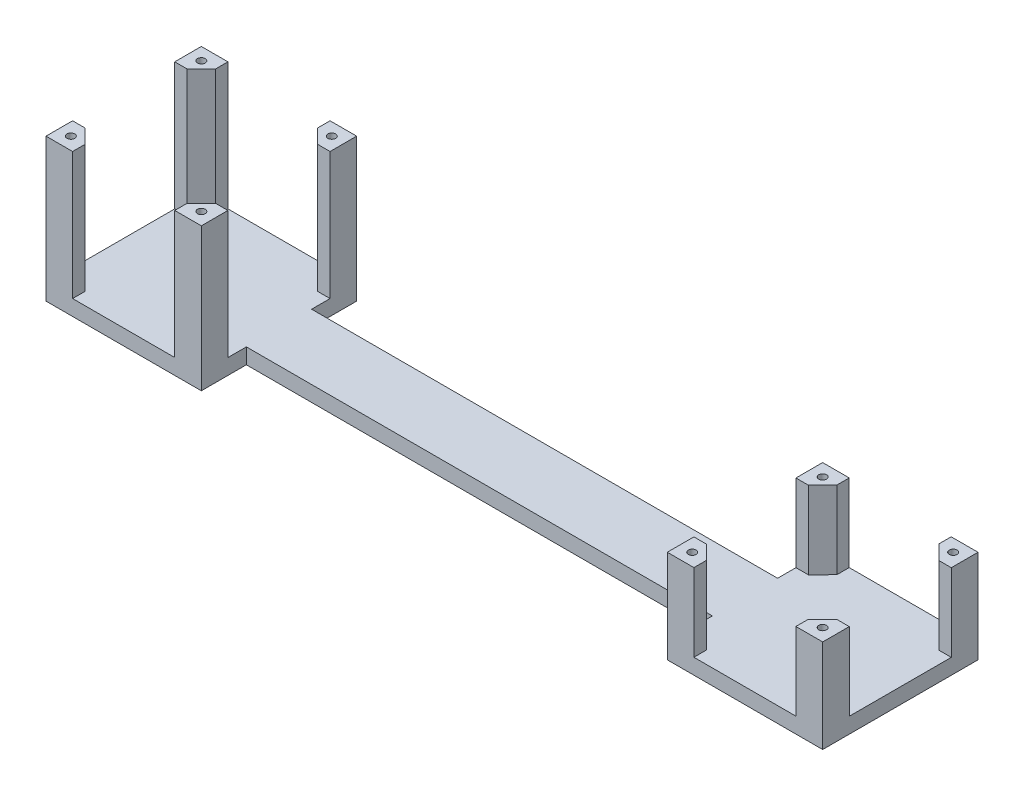
from build123d import *

# Parameters (mm, degrees)
BASE_EXTR_DEPTH                 = 5
MOTOR_1_EXTR_DEPTH              = 41
SHAFT_MOTOR_SUPPORT_EXTR_DEPTH  = 25
TAP_DRILL_FOR_M3X0_5_TAP1_D     = 2.5
TAP_DRILL_FOR_M3X0_5_TAP1_DEPTH = 41
TAP_DRILL_FOR_M3X0_5_TAP1_TIP   = 0.751075774


with BuildPart() as part:
    # Base_sch → base_extr (new body)
    with BuildSketch(Plane(origin=(0, 0, 0), x_dir=(1, 0, 0), z_dir=(0, 1, 0))):
        Polygon((25, 10.5), (25, 25), (-25, 25), (-25, -25), (25, -25), (25, -10.5), (175, -10.5), (175, -25), (225.013827764, -25), (225.013827764, 25), (175, 25), (175, 10.5), align=None)
    extrude(amount=BASE_EXTR_DEPTH)

    # motor_support_sch → Motor_1_extr (add)
    with BuildSketch(Plane(origin=(0, 5, 0), x_dir=(1, 0, 0), z_dir=(0, 1, 0))):
        Polygon((-25, 16.439389634), (-25, 25), (-16.439389634, 25), (-16.439389634, 21), (-18.719694817, 18.719694817), (-21, 16.439389634), align=None)
        Polygon((16.439389634, 25), (25, 25), (25, 16.439389634), (21, 16.439389634), (18.719694817, 18.719694817), (16.439389634, 21), align=None)
        Polygon((25, -16.439389634), (25, -25), (16.439389634, -25), (16.439389634, -21), (18.719694817, -18.719694817), (21, -16.439389634), align=None)
        Polygon((-18.719694817, -18.719694817), (-21, -16.439389634), (-25, -16.439389634), (-25, -25), (-16.439389634, -25), (-16.439389634, -21), align=None)
    extrude(amount=MOTOR_1_EXTR_DEPTH)

    # shaft_motor_support_sch → shaft_motor_support_extr (add)
    with BuildSketch(Plane(origin=(0, 5, 0), x_dir=(1, 0, 0), z_dir=(0, 1, 0))):
        Polygon((183.560610366, -21), (179, -16.439389634), (175, -16.439389634), (175, -25), (183.560610366, -25), align=None)
        Polygon((216.38573482, -21), (216.38573482, -25), (225.013827764, -25), (225.013827764, -16.439389634), (221.056642929, -16.439389634), align=None)
        Polygon((183.560610366, 25), (175, 25), (175, 16.402508948), (179, 16.402508948), (183.560610366, 21.024047525), align=None)
        Polygon((225.013827764, 25), (216.38573482, 25), (216.38573482, 21.024047525), (221.056642929, 16.402508948), (225.013827764, 16.402508948), align=None)
    extrude(amount=SHAFT_MOTOR_SUPPORT_EXTR_DEPTH)

    # Tap Drill for M3x0.5 Tap1
    with Locations(Plane(origin=(0, 46, 0), x_dir=(1, 0, 0), z_dir=(0, 1, 0))):
        with Locations((-21, -21), (21, -21), (21, 21), (-21, 21), (179.013827764, 21), (221.013827764, 21), (221.013827764, -21), (179.013827764, -21)):
            Hole(TAP_DRILL_FOR_M3X0_5_TAP1_D / 2, depth=TAP_DRILL_FOR_M3X0_5_TAP1_DEPTH)
            with Locations((0, 0, -(TAP_DRILL_FOR_M3X0_5_TAP1_DEPTH + TAP_DRILL_FOR_M3X0_5_TAP1_TIP / 2))):  # 118° drill point
                Cone(0, TAP_DRILL_FOR_M3X0_5_TAP1_D / 2, TAP_DRILL_FOR_M3X0_5_TAP1_TIP, mode=Mode.SUBTRACT)


solid = part.part
